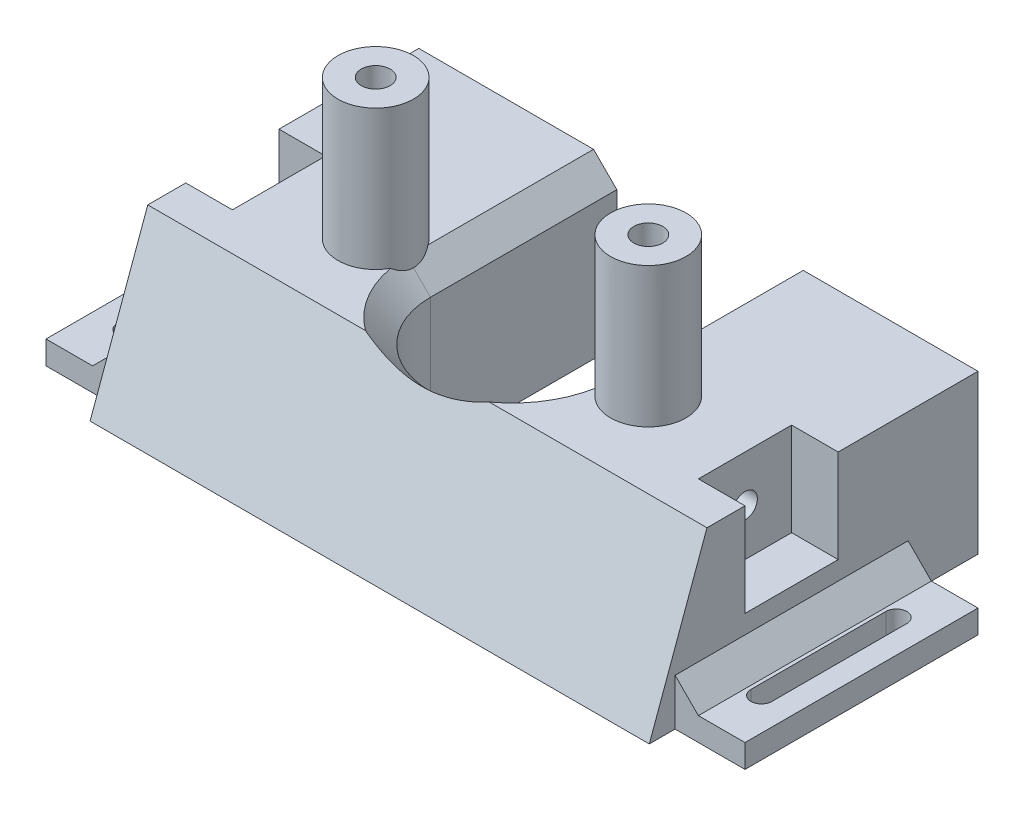
from build123d import *

# Parameters (mm, degrees)
SKETCH1_W               = 120
SKETCH1_H               = 80
BOSS_EXTRUDE1_DEPTH     = 60
CUT_EXTRUDE1_DEPTH      = 94.808315196
SKETCH10_R              = 3.1
CUT_EXTRUDE4_DEPTH      = 20
BOSS_EXTRUDE2_START     = 30
SKETCH4_R               = 8.1
SKETCH4_R_2             = 3.1
BOSS_EXTRUDE2_DEPTH     = 30
SKETCH5_W               = 20
SKETCH5_H               = 20
CUT_EXTRUDE3_DEPTH      = 10
CUT_EXTRUDE5_REACH      = 149.648
CUT_EXTRUDE5_END_RADIUS = 3.1
SKETCH6_R               = 2.65
DRAFT2_ANGLE            = -20
CHAMFER3_SIZE           = 5
SKETCH11_W              = 95.774005991
SKETCH11_H              = 26
CUT_EXTRUDE6_DEPTH      = 156.241747021
SKETCH13_W              = 15
SKETCH13_H              = 50
BOSS_EXTRUDE3_DEPTH     = 5
CHAMFER4_SIZE           = 5


with BuildPart() as part:
    # Sketch1 → Boss-Extrude1 (new body)
    with BuildSketch(Plane(origin=(0, 0, 0), x_dir=(1, 0, 0), z_dir=(0, 1, 0))):
        Rectangle(SKETCH1_W, SKETCH1_H)
    extrude(amount=BOSS_EXTRUDE1_DEPTH)

    # Sketch2 → Cut-Extrude1 (cut, through all)
    with BuildSketch(Plane(origin=(0, 60, 0), x_dir=(1, 0, 0), z_dir=(0, 1, 0))):
        with BuildLine():
            Line((-17.5, 0), (-17.5, 40))
            Line((-17.5, 40), (17.5, 40))
            Line((17.5, 40), (17.5, 0))
            ThreePointArc((17.5, 0), (0, -17.5), (-17.5, 0))
        make_face()
    extrude(amount=-CUT_EXTRUDE1_DEPTH, mode=Mode.SUBTRACT)

    # Sketch10 → Cut-Extrude4 (cut)
    with BuildSketch(Plane(origin=(0, 60, 0), x_dir=(1, 0, 0), z_dir=(0, 1, 0))):
        with Locations(Location((-29.25, 0, 0), (0, 0, 270))):
            Circle(SKETCH10_R)
        with Locations(Location((29.25, 0, 0), (0, 0, 270))):
            Circle(SKETCH10_R)
    extrude(amount=-CUT_EXTRUDE4_DEPTH, mode=Mode.SUBTRACT)

    # Sketch4 → Boss-Extrude2 (add)
    # profile 1 of 2: a face of its own
    with BuildSketch(Plane(origin=(0, 60, 0), x_dir=(1, 0, 0), z_dir=(0, 1, 0)).offset(BOSS_EXTRUDE2_START)):
        with Locations(Location((29.25, 0, 0), (0, 0, 90))):
            Circle(SKETCH4_R)
        with Locations(Location((29.25, 0, 0), (0, 0, 270))):
            Circle(SKETCH4_R_2, mode=Mode.SUBTRACT)
    # profile 2 of 2: a face of its own
    with BuildSketch(Plane(origin=(0, 60, 0), x_dir=(1, 0, 0), z_dir=(0, 1, 0)).offset(BOSS_EXTRUDE2_START)):
        with Locations(Location((-29.25, 0, 0), (0, 0, 90))):
            Circle(SKETCH4_R)
        with Locations(Location((-29.25, 0, 0), (0, 0, 270))):
            Circle(SKETCH4_R_2, mode=Mode.SUBTRACT)
    extrude(amount=-BOSS_EXTRUDE2_DEPTH)

    # Sketch5 → Cut-Extrude3 (cut)
    with BuildSketch(Plane(origin=(60, 0, 0), x_dir=(0, 0, -1), z_dir=(1, 0, 0))):
        with Locations((0, 50)):
            Rectangle(SKETCH5_W, SKETCH5_H)
    cut_extrude3 = extrude(amount=-CUT_EXTRUDE3_DEPTH, mode=Mode.SUBTRACT)

    # Cut-Extrude5: up to this cylinder (the profile starts outside it)
    cut_extrude5_end = Plane(origin=(29.25, 50, 0), z_dir=(0, 1, 0)) * Cylinder(CUT_EXTRUDE5_END_RADIUS, 306.496, mode=Mode.PRIVATE)
    # Sketch6 → Cut-Extrude5 (cut, up to the surface)
    with BuildSketch(Plane(origin=(50, 0, 0), x_dir=(0, 0, -1), z_dir=(1, 0, 0)), mode=Mode.PRIVATE) as cut_extrude5_sk1:
        with Locations((0, 50)):
            Circle(SKETCH6_R)
    cut_extrude5_tool1 = extrude(cut_extrude5_sk1.sketch, amount=-CUT_EXTRUDE5_REACH, mode=Mode.PRIVATE) - cut_extrude5_end
    cut_extrude5 = cut_extrude5_tool1.solids().sort_by_distance((50, 50, 0))[0]
    add(cut_extrude5, mode=Mode.SUBTRACT)

    # Mirror2: Cut-Extrude3, Cut-Extrude5 across plane
    add(cut_extrude3.mirror(Plane(origin=(0, 0, 0), x_dir=(0, 0, 1), z_dir=(1, 0, 0))), mode=Mode.SUBTRACT)
    add(cut_extrude5.mirror(Plane(origin=(0, 0, 0), x_dir=(0, 0, 1), z_dir=(1, 0, 0))), mode=Mode.SUBTRACT)

    # Draft2
    draft2_faces = [part.faces().sort_by_distance(p)[0] for p in [
        (0, 30, 40),
    ]]
    draft(draft2_faces, Plane(origin=(0, 0, 0), x_dir=(0, 0, -1), z_dir=(0, -1, 0)), DRAFT2_ANGLE)

    # Chamfer3
    # the kernel refuses this chamfer: 5 mm, written as the material it takes off along each edge
    with BuildSketch(Plane(origin=(0, 60, 0), x_dir=(1, 0, 0), z_dir=(0, 0, -1))) as chamfer3_piece_1_section:
        Polygon((17.5 + CHAMFER3_SIZE, 0), (17.5, CHAMFER3_SIZE), (17.5, 0), align=None)
    chamfer3_piece_1 = revolve(axis=Axis((0, 60, 0), (0, -1, 0)), revolution_arc=180, mode=Mode.PRIVATE)
    chamfer3_piece_1 = chamfer3_piece_1 - Plane(origin=(-29.25, 57.566241365, 0), x_dir=(0, 0, -1), z_dir=(0, 1, 0)) * Cylinder(8.1, 90, mode=Mode.PRIVATE)
    chamfer3_piece_1 = chamfer3_piece_1 - Plane(origin=(29.25, 57.566241365, 0), x_dir=(0, 0, -1), z_dir=(0, 1, 0)) * Cylinder(8.1, 90, mode=Mode.PRIVATE)
    add(chamfer3_piece_1, mode=Mode.SUBTRACT)
    with BuildSketch(Plane(origin=(17.5, 60, -52.85841494), x_dir=(0.9996219169112968, 0.027495876610586317, 0), z_dir=(0, 0, 1))) as chamfer3_piece_2_section:
        Polygon((CHAMFER3_SIZE * 0.999621916911, -CHAMFER3_SIZE * 0.0274958766106), (-CHAMFER3_SIZE * 0.0274958766106, -CHAMFER3_SIZE * 0.999621916911), (0, 0), align=None)
    chamfer3_piece_2 = extrude(amount=52.85841494, mode=Mode.PRIVATE)
    chamfer3_piece_2 = chamfer3_piece_2 - Plane(origin=(29.25, 58.344986743, 0), x_dir=(0, 0, -1), z_dir=(0, 1, 0)) * Cylinder(8.1, 126, mode=Mode.PRIVATE)
    add(chamfer3_piece_2, mode=Mode.SUBTRACT)
    with BuildSketch(Plane(origin=(-17.5, 60, 0), x_dir=(-0.9996219169112968, 0.027495876610586317, 0), z_dir=(0, 0, -1))) as chamfer3_piece_3_section:
        Polygon((CHAMFER3_SIZE * 0.999621916911, -CHAMFER3_SIZE * 0.0274958766106), (-CHAMFER3_SIZE * 0.0274958766106, -CHAMFER3_SIZE * 0.999621916911), (0, 0), align=None)
    chamfer3_piece_3 = extrude(amount=52.85841494, mode=Mode.PRIVATE)
    chamfer3_piece_3 = chamfer3_piece_3 - Plane(origin=(-29.25, 58.344986743, 0), x_dir=(0, 0, -1), z_dir=(0, 1, 0)) * Cylinder(8.1, 126, mode=Mode.PRIVATE)
    add(chamfer3_piece_3, mode=Mode.SUBTRACT)

    # Sketch11 → Cut-Extrude6 (cut, through all)
    with BuildSketch(Plane(origin=(60, 0, 0), x_dir=(0, 0, -1), z_dir=(1, 0, 0))):
        with Locations((1.578345518, 13)):
            Rectangle(SKETCH11_W, SKETCH11_H)
    extrude(amount=-CUT_EXTRUDE6_DEPTH, mode=Mode.SUBTRACT)

    # Sketch13 → Boss-Extrude3 (add)
    with BuildSketch(Plane.XZ.offset(-26)):
        with Locations((67.5, 0)):
            Rectangle(SKETCH13_W, SKETCH13_H)
        with BuildLine():
            Line((70.25, 14.478646417), (70.25, -14.478646417))
            ThreePointArc((70.25, -14.478646417), (68, -16.728646417), (65.75, -14.478646417))
            Line((65.75, -14.478646417), (65.75, 14.478646417))
            ThreePointArc((65.75, 14.478646417), (68, 16.728646417), (70.25, 14.478646417))
        make_face(mode=Mode.SUBTRACT)
    boss_extrude3 = extrude(amount=-BOSS_EXTRUDE3_DEPTH)

    # Mirror3: Boss-Extrude3 across plane
    add(boss_extrude3.mirror(Plane(origin=(0, 0, 0), x_dir=(0, 0, 1), z_dir=(1, 0, 0))))

    # Chamfer4
    chamfer4_edges = [part.edges().sort_by_distance(p)[0] for p in [
        (60, 31, 0),
        (-60, 31, 0),
    ]]
    chamfer(chamfer4_edges, length=CHAMFER4_SIZE)


solid = part.part
